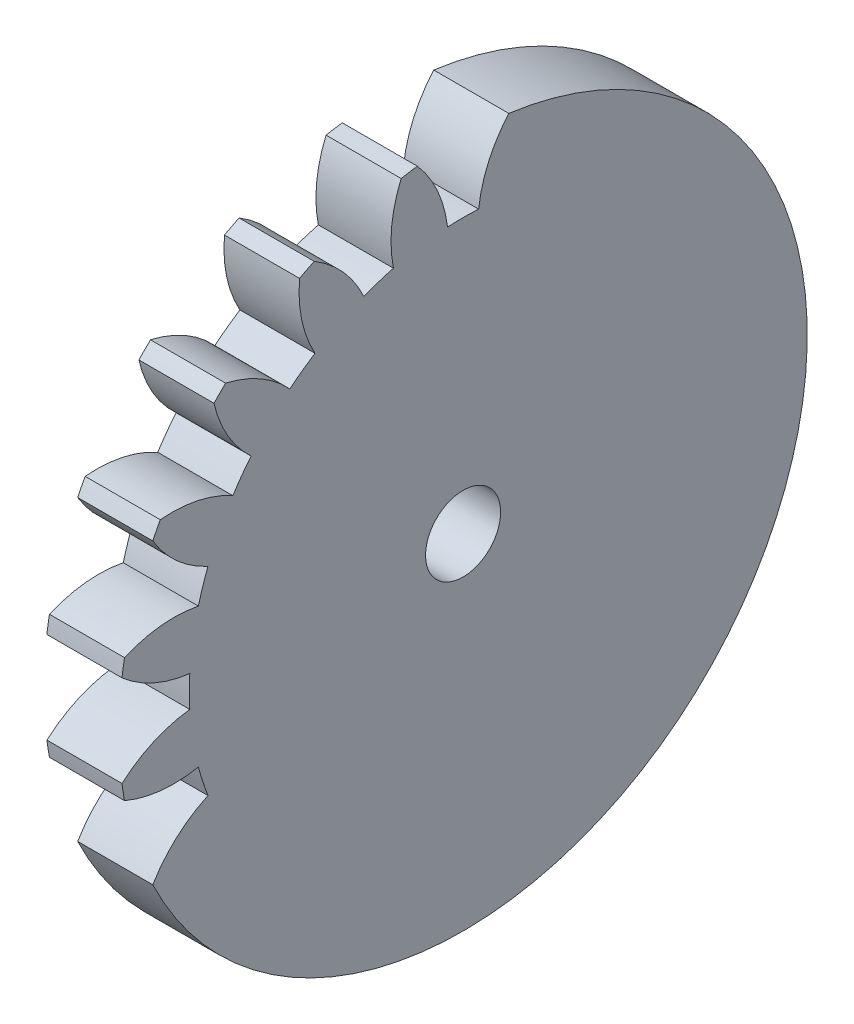
from build123d import *

# Parameters (mm, degrees)
BASPROSKE_W     = 3
BASPROSKE_H     = 13.75
TOOTHCUT_DEPTH  = 20.67549237
TEETHCUTS_COUNT = 7
TEETHCUTS_ANGLE = 108
BORSKE_R        = 1.5
BORE_DEPTH      = 50.0000508


with BuildPart() as part:
    # BasProSke → Base-Revolve (revolve)
    with BuildSketch(Plane(origin=(0, 0, 0), x_dir=(1, 0, 0), z_dir=(0, 1, 0))):
        with Locations((1.5, 6.875)):
            Rectangle(BASPROSKE_W, BASPROSKE_H)
    revolve(axis=Axis((-10, 0, 0), (1, 0, 0)))

    # TooCutSke → ToothCut (cut, through all)
    with BuildSketch(Plane(origin=(0, 0, 0), x_dir=(0, 0, -1), z_dir=(1, 0, 0))):
        with BuildLine():
            ThreePointArc((0.62110296, 10.918848994), (0, 10.9365), (-0.62110296, 10.918848994))
            ThreePointArc((-0.62110296, 10.918848994), (-1.024517052, 12.378857135), (-1.846615859, 13.651067908))
            ThreePointArc((-1.846615859, 13.651067908), (0, 13.7754), (1.846615859, 13.651067908))
            ThreePointArc((1.846615859, 13.651067908), (1.024517052, 12.378857135), (0.62110296, 10.918848994))
        make_face()
    toothcut = extrude(amount=TOOTHCUT_DEPTH, mode=Mode.SUBTRACT)

    # TeethCuts: ToothCut ×7 about axis
    teethcuts_axis = Axis((-10, 0, 0), (1, 0, 0))
    for i in range(1, TEETHCUTS_COUNT):
        add(toothcut.rotate(teethcuts_axis, i * TEETHCUTS_ANGLE / (TEETHCUTS_COUNT - 1)), mode=Mode.SUBTRACT)

    # BorSke → Bore (cut, symmetric)
    with BuildSketch(Plane(origin=(0, 0, 0), x_dir=(0, 0, -1), z_dir=(1, 0, 0))):
        Circle(BORSKE_R)
    extrude(amount=BORE_DEPTH, both=True, mode=Mode.SUBTRACT)


solid = part.part
